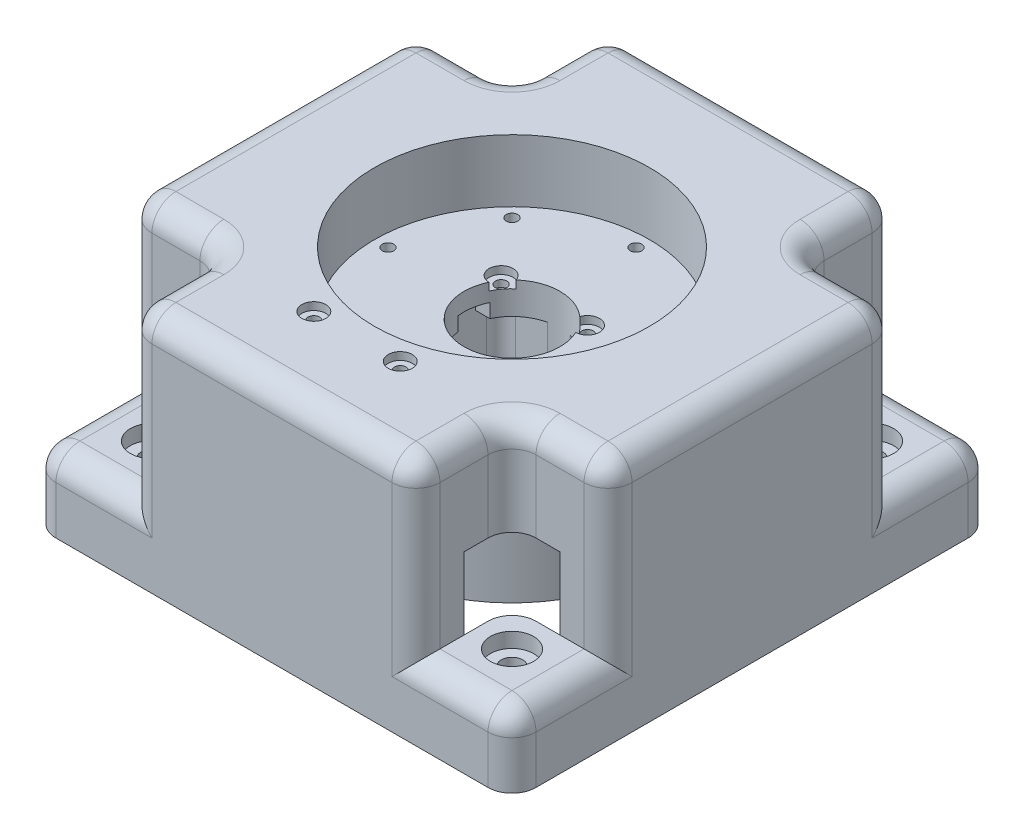
from build123d import *
from build123d.topology import SkipClean

# Parameters (mm, degrees)
SKETCH_1_W                     = 100
SKETCH_1_H                     = 100
EXTRUDE_1_DEPTH                = 50
SKETCH_2_W                     = 80
SKETCH_2_H                     = 80
CUT_EXTRUDE_2_DEPTH            = 30
SKETCH_3_R                     = 28.65
CUT_EXTRUDE_3_DEPTH            = 87.602540378
EXTRUDE_START                  = -13
SKETCH_4_R                     = 30
SKETCH_4_R_2                   = 10
EXTRUDE_4_DEPTH                = 30
HOLE_WIZARD_M2_1_D             = 2.4
HOLE_WIZARD_M2_1_DEPTH         = 10
HOLE_WIZARD_M2_1_TIP           = 0.721032743
CUT_EXTRUDE_START              = -23.4
CUT_EXTRUDE_4_OUTLINE_R        = 1
CUT_EXTRUDE_4_DEPTH            = 23.4
CUT_EXTRUDE_START_2            = -28.2
CUT_EXTRUDE_6_OUTLINE_R        = 1.2
CUT_EXTRUDE_6_DEPTH            = 4.8
SKETCH_8_5_R                   = 1
CUT_EXTRUDE_7_DEPTH            = 83.758685345
EXTRUDE_START_2                = -23
SKETCH_8_6_R                   = 1
EXTRUDE_5_DEPTH                = 6.6
CUT_EXTRUDE_START_3            = -26.3
CUT_EXTRUDE_9_DEPTH            = 2.9
HOLE_WIZARD_M2_1_2_D           = 2.4
HOLE_WIZARD_M2_1_2_DEPTH       = 3
HOLE_WIZARD_M2_1_2_CBORE_D     = 5
HOLE_WIZARD_M2_1_2_CBORE_DEPTH = 1.6
HOLE_WIZARD_M2_1_2_TIP         = 0.721032743
HOLE_WIZARD_M2_2_D             = 2.4
HOLE_WIZARD_M2_2_DEPTH         = 3
HOLE_WIZARD_M2_2_CBORE_D       = 5
HOLE_WIZARD_M2_2_CBORE_DEPTH   = 1.6
HOLE_WIZARD_M2_2_TIP           = 0.721032743
CUT_EXTRUDE_10_DEPTH           = 35
EXTRUDE_START_3                = -35
EXTRUDE_7_DEPTH                = 15
FILLET_2_R                     = 5
SKETCH_18_R                    = 0.5
CUT_EXTRUDE_12_DEPTH           = 79.89866919
HOLE_WIZARD_M4_1_D             = 4.5
HOLE_WIZARD_M4_1_CBORE_D       = 9
HOLE_WIZARD_M4_1_CBORE_DEPTH   = 3.1


# Read off the part's stored shape, not the designer's step: 컷-돌출4, 컷-돌출6
with BuildPart() as part:
    # 스케치1 → 보스-돌출1 (new body)
    with BuildSketch(Plane(origin=(0, 0, 0), x_dir=(1, 0, 0), z_dir=(0, 1, 0))):
        Rectangle(SKETCH_1_W, SKETCH_1_H)
    extrude(amount=EXTRUDE_1_DEPTH)

    # 스케치2 → 컷-돌출2 (cut)
    with BuildSketch(Plane.XZ):
        Rectangle(SKETCH_2_W, SKETCH_2_H)
    extrude(amount=-CUT_EXTRUDE_2_DEPTH, mode=Mode.SUBTRACT)

    # 스케치3 → 컷-돌출3 (cut, through all)
    with BuildSketch(Plane(origin=(0, 50, 0), x_dir=(1, 0, 0), z_dir=(0, 1, 0))):
        with Locations(Location((0, 0, 0), (0, 0, 270))):
            Circle(SKETCH_3_R)
    extrude(amount=-CUT_EXTRUDE_3_DEPTH, mode=Mode.SUBTRACT)

    # 스케치4 → 보스-돌출4 (add)
    with BuildSketch(Plane(origin=(0, 50, 0), x_dir=(1, 0, 0), z_dir=(0, 1, 0)).offset(EXTRUDE_START)):
        with Locations(Location((0, 0, 0), (0, 0, 270))):
            Circle(SKETCH_4_R)
        with Locations(Location((0, 0, 0), (0, 0, 270))):
            Circle(SKETCH_4_R_2, mode=Mode.SUBTRACT)
    extrude(amount=-EXTRUDE_4_DEPTH)

    # Hole Wizard M2 _ _1
    with Locations(Plane(origin=(0, 37, 0), x_dir=(1, 0, 0), z_dir=(0, 1, 0))):
        with Locations((0, 25.815), (18.253961556, 18.253961556), (25.815, 0), (18.253961556, -18.253961556), (0, -25.815), (-18.253961556, -18.253961556), (-25.815, 0), (-18.253961556, 18.253961556)):
            Hole(HOLE_WIZARD_M2_1_D / 2, depth=HOLE_WIZARD_M2_1_DEPTH)
            with Locations((0, 0, -(HOLE_WIZARD_M2_1_DEPTH + HOLE_WIZARD_M2_1_TIP / 2))):  # 118° drill point
                Cone(0, HOLE_WIZARD_M2_1_D / 2, HOLE_WIZARD_M2_1_TIP, mode=Mode.SUBTRACT)

    # 컷-돌출4 outline → 컷-돌출4 (cut)
    with BuildSketch(Plane.XZ.offset(-7).offset(CUT_EXTRUDE_START)):
        with Locations((9, 32.275)):
            Circle(CUT_EXTRUDE_4_OUTLINE_R)
        with BuildLine():
            Line((12, 29.925), (9.65, 29.925))
            ThreePointArc((9.65, 29.925), (7.528679656, 30.803679656), (6.65, 32.925))
            Line((6.65, 32.925), (6.65, 35.275))
            Line((6.65, 35.275), (-6.65, 35.275))
            Line((-6.65, 35.275), (-6.65, 32.925))
            ThreePointArc((-6.65, 32.925), (-7.528679656, 30.803679656), (-9.65, 29.925))
            Line((-9.65, 29.925), (-12, 29.925))
            Line((-12, 29.925), (-12, -6.725))
            ThreePointArc((-12, -6.725), (-11.121320344, -8.846320344), (-9, -9.725))
            Line((-9, -9.725), (-2.329028768, -9.725))
            ThreePointArc((-2.329028768, -9.725), (0, 10), (2.329028768, -9.725))
            Line((2.329028768, -9.725), (9, -9.725))
            ThreePointArc((9, -9.725), (11.121320344, -8.846320344), (12, -6.725))
            Line((12, -6.725), (12, 29.925))
        make_face()
        with Locations((-9, 32.275)):
            Circle(CUT_EXTRUDE_4_OUTLINE_R)
    extrude(amount=CUT_EXTRUDE_4_DEPTH, mode=Mode.SUBTRACT)

    # 컷-돌출6 outline → 컷-돌출6 (cut)
    with BuildSketch(Plane.XZ.offset(-7).offset(CUT_EXTRUDE_START_2)):
        with BuildLine():
            Line((2.119994104, 29.925), (-2.119994104, 29.925))
            ThreePointArc((-2.119994104, 29.925), (-7.163744245, 29.132126053), (-12, 27.49545417))
            Line((-12, 27.49545417), (-12, 6.525))
            Line((-12, 6.525), (-7.577887239, 6.525))
            ThreePointArc((-7.577887239, 6.525), (0, 10), (7.577887239, 6.525))
            Line((7.577887239, 6.525), (12, 6.525))
            Line((12, 6.525), (12, 27.49545417))
            ThreePointArc((12, 27.49545417), (7.163744245, 29.132126053), (2.119994104, 29.925))
        make_face()
        with Locations((0, 25.815)):
            Circle(CUT_EXTRUDE_6_OUTLINE_R, mode=Mode.SUBTRACT)
    extrude(amount=CUT_EXTRUDE_6_DEPTH, mode=Mode.SUBTRACT)

    # 스케치8<5> → 컷-돌출7 (cut, through all)
    with SkipClean():  # the faces are left unmerged after this step: merging them gives an invalid solid
        with BuildSketch(Plane.XZ.offset(-7)):
            with Locations(Location((9, 32.275, 0), (0, 0, 270))):
                Circle(SKETCH_8_5_R)
            with Locations(Location((-9, 32.275, 0), (0, 0, 270))):
                Circle(SKETCH_8_5_R)
            with Locations(Location((9, -6.725, 0), (0, 0, 270))):
                Circle(SKETCH_8_5_R)
            with Locations(Location((-9, -6.725, 0), (0, 0, 270))):
                Circle(SKETCH_8_5_R)
        extrude(amount=-CUT_EXTRUDE_7_DEPTH, mode=Mode.SUBTRACT)
    add(part.part.scale(1), mode=Mode.REPLACE)  # the faces are merged on a copy

    # 스케치8<6> → 보스-돌출5 (add)
    # profile 1 of 2: a face of its own
    with SkipClean():  # the faces are left unmerged after this step: merging them gives an invalid solid
        with BuildSketch(Plane.XZ.offset(-7).offset(EXTRUDE_START_2)):
            with BuildLine():
                Line((9.65, 29.925), (12, 29.925))
                Line((12, 29.925), (12, 32.275))
                ThreePointArc((12, 32.275), (11.121320344, 34.396320344), (9, 35.275))
                Line((9, 35.275), (6.65, 35.275))
                Line((6.65, 35.275), (6.65, 32.925))
                ThreePointArc((6.65, 32.925), (7.528679656, 30.803679656), (9.65, 29.925))
            make_face()
            with Locations((9, 32.275)):
                Circle(SKETCH_8_6_R, mode=Mode.SUBTRACT)
        # profile 2 of 2: a face of its own
        with BuildSketch(Plane.XZ.offset(-7).offset(EXTRUDE_START_2)):
            with BuildLine():
                Line((-12, 32.275), (-12, 29.925))
                Line((-12, 29.925), (-9.65, 29.925))
                ThreePointArc((-9.65, 29.925), (-7.528679656, 30.803679656), (-6.65, 32.925))
                Line((-6.65, 32.925), (-6.65, 35.275))
                Line((-6.65, 35.275), (-9, 35.275))
                ThreePointArc((-9, 35.275), (-11.121320344, 34.396320344), (-12, 32.275))
            make_face()
            with Locations((-9, 32.275)):
                Circle(SKETCH_8_6_R, mode=Mode.SUBTRACT)
        extrude(amount=EXTRUDE_5_DEPTH)

    # 스케치8<7> → 컷-돌출9 (cut)
    with SkipClean():  # the faces are left unmerged after this step: merging them gives an invalid solid
        with BuildSketch(Plane.XZ.offset(-7).offset(CUT_EXTRUDE_START_3)):
            with BuildLine():
                Line((12, 1.335), (9.910488131, 1.335))
                ThreePointArc((9.910488131, 1.335), (9.977596938, 0.668998762), (10, 0))
                ThreePointArc((10, 0), (9.74603575, -2.239372044), (8.99704257, -4.365))
                Line((8.99704257, -4.365), (12, -4.365))
                Line((12, -4.365), (12, 1.335))
            make_face()
            with BuildLine():
                ThreePointArc((-8.99704257, -4.365), (-9.874015359, -1.58234658), (-9.910488131, 1.335))
                Line((-9.910488131, 1.335), (-12, 1.335))
                Line((-12, 1.335), (-12, -4.365))
                Line((-12, -4.365), (-8.99704257, -4.365))
            make_face()
        extrude(amount=CUT_EXTRUDE_9_DEPTH, mode=Mode.SUBTRACT)

    # Hole Wizard M2 _ _ _ _1 2
    with Locations(Plane(origin=(0, 37, 0), x_dir=(1, 0, 0), z_dir=(0, 1, 0))):
        with Locations((-9, 6.725), (9, 6.725)):
            CounterBoreHole(HOLE_WIZARD_M2_1_2_D / 2, HOLE_WIZARD_M2_1_2_CBORE_D / 2, HOLE_WIZARD_M2_1_2_CBORE_DEPTH, depth=HOLE_WIZARD_M2_1_2_DEPTH)
            with Locations((0, 0, -(HOLE_WIZARD_M2_1_2_DEPTH + HOLE_WIZARD_M2_1_2_TIP / 2))):  # 118° drill point
                Cone(0, HOLE_WIZARD_M2_1_2_D / 2, HOLE_WIZARD_M2_1_2_TIP, mode=Mode.SUBTRACT)

    # M2 남비 머리 나사용 카운터보어2
    with Locations(Plane(origin=(0, 50, 0), x_dir=(1, 0, 0), z_dir=(0, 1, 0))):
        with Locations((-9, -32.275), (9, -32.275)):
            CounterBoreHole(HOLE_WIZARD_M2_2_D / 2, HOLE_WIZARD_M2_2_CBORE_D / 2, HOLE_WIZARD_M2_2_CBORE_DEPTH, depth=HOLE_WIZARD_M2_2_DEPTH)
            with Locations((0, 0, -(HOLE_WIZARD_M2_2_DEPTH + HOLE_WIZARD_M2_2_TIP / 2))):  # 118° drill point
                Cone(0, HOLE_WIZARD_M2_2_D / 2, HOLE_WIZARD_M2_2_TIP, mode=Mode.SUBTRACT)

    # 스케치13 → 컷-돌출10 (cut)
    with BuildSketch(Plane(origin=(0, 50, 0), x_dir=(1, 0, 0), z_dir=(0, 1, 0))):
        with BuildLine():
            Line((-50, 50), (-30, 50))
            Line((-30, 50), (-30, 35))
            ThreePointArc((-30, 35), (-31.464466094, 31.464466094), (-35, 30))
            Line((-35, 30), (-50, 30))
            Line((-50, 30), (-50, 50))
        make_face()
        with BuildLine():
            Line((50, 50), (30, 50))
            Line((30, 50), (30, 35))
            ThreePointArc((30, 35), (31.464466094, 31.464466094), (35, 30))
            Line((35, 30), (50, 30))
            Line((50, 30), (50, 50))
        make_face()
        with BuildLine():
            Line((50, -50), (30, -50))
            Line((30, -50), (30, -35))
            ThreePointArc((30, -35), (31.464466094, -31.464466094), (35, -30))
            Line((35, -30), (50, -30))
            Line((50, -30), (50, -50))
        make_face()
        with BuildLine():
            Line((-50, -50), (-30, -50))
            Line((-30, -50), (-30, -35))
            ThreePointArc((-30, -35), (-31.464466094, -31.464466094), (-35, -30))
            Line((-35, -30), (-50, -30))
            Line((-50, -30), (-50, -50))
        make_face()
    extrude(amount=-CUT_EXTRUDE_10_DEPTH, mode=Mode.SUBTRACT)

    # 스케치13<2> → 보스-돌출7 (add)
    with BuildSketch(Plane(origin=(0, 50, 0), x_dir=(1, 0, 0), z_dir=(0, 1, 0)).offset(EXTRUDE_START_3)):
        with BuildLine():
            Line((-50, 50), (-30, 50))
            Line((-30, 50), (-30, 35))
            ThreePointArc((-30, 35), (-31.464466094, 31.464466094), (-35, 30))
            Line((-35, 30), (-50, 30))
            Line((-50, 30), (-50, 50))
        make_face()
        with BuildLine():
            Line((50, 50), (30, 50))
            Line((30, 50), (30, 35))
            ThreePointArc((30, 35), (31.464466094, 31.464466094), (35, 30))
            Line((35, 30), (50, 30))
            Line((50, 30), (50, 50))
        make_face()
        with BuildLine():
            Line((50, -50), (30, -50))
            Line((30, -50), (30, -35))
            ThreePointArc((30, -35), (31.464466094, -31.464466094), (35, -30))
            Line((35, -30), (50, -30))
            Line((50, -30), (50, -50))
        make_face()
        with BuildLine():
            Line((-50, -50), (-30, -50))
            Line((-30, -50), (-30, -35))
            ThreePointArc((-30, -35), (-31.464466094, -31.464466094), (-35, -30))
            Line((-35, -30), (-50, -30))
            Line((-50, -30), (-50, -50))
        make_face()
    extrude(amount=-EXTRUDE_7_DEPTH)

    # 필렛2
    fillet_2_edges = [part.edges().sort_by_distance(p)[0] for p in [
        (-50, 50, 0),
        (-50, 7.5, -50),
        (-30, 32.5, -50),
        (-50, 15, -40),
        (-50, 32.5, -30),
        (-40, 15, -50),
        (-42.5, 50, -30),
        (-31.464466094, 50, -31.464466094),
        (-30, 50, -42.5),
        (0, 50, 50),
        (50, 50, 0),
        (0, 50, -50),
        (50, 7.5, 50),
        (-50, 7.5, 50),
        (50, 7.5, -50),
        (50, 32.5, -30),
        (50, 15, -40),
        (40, 15, -50),
        (30, 32.5, -50),
        (30, 50, -42.5),
        (31.464466094, 50, -31.464466094),
        (42.5, 50, -30),
        (30, 32.5, 50),
        (50, 15, 40),
        (50, 32.5, 30),
        (40, 15, 50),
        (42.5, 50, 30),
        (31.464466094, 50, 31.464466094),
        (30, 50, 42.5),
        (-50, 32.5, 30),
        (-50, 15, 40),
        (-40, 15, 50),
        (-30, 32.5, 50),
        (-30, 50, 42.5),
        (-31.464466094, 50, 31.464466094),
        (-42.5, 50, 30),
    ]]
    fillet(fillet_2_edges, radius=FILLET_2_R)

    # 스케치18 → 컷-돌출12 (cut, through all)
    with BuildSketch(Plane(origin=(0, 15, 0), x_dir=(1, 0, 0), z_dir=(0, 1, 0))):
        with Locations(Location((-37.5, -37.5, 0), (0, 0, 270))):
            Circle(SKETCH_18_R)
        with Locations(Location((-37.5, 37.5, 0), (0, 0, 270))):
            Circle(SKETCH_18_R)
        with Locations(Location((37.5, 37.5, 0), (0, 0, 270))):
            Circle(SKETCH_18_R)
        with Locations(Location((37.5, -37.5, 0), (0, 0, 270))):
            Circle(SKETCH_18_R)
    extrude(amount=-CUT_EXTRUDE_12_DEPTH, mode=Mode.SUBTRACT)

    # M4 남비 머리 나사용 카운터보어1 (through all)
    with Locations(Plane(origin=(0, 15, 0), x_dir=(1, 0, 0), z_dir=(0, 1, 0))):
        with Locations((-37.5, 37.5), (37.5, 37.5), (37.5, -37.5), (-37.5, -37.5)):
            CounterBoreHole(HOLE_WIZARD_M4_1_D / 2, HOLE_WIZARD_M4_1_CBORE_D / 2, HOLE_WIZARD_M4_1_CBORE_DEPTH)


solid = part.part
